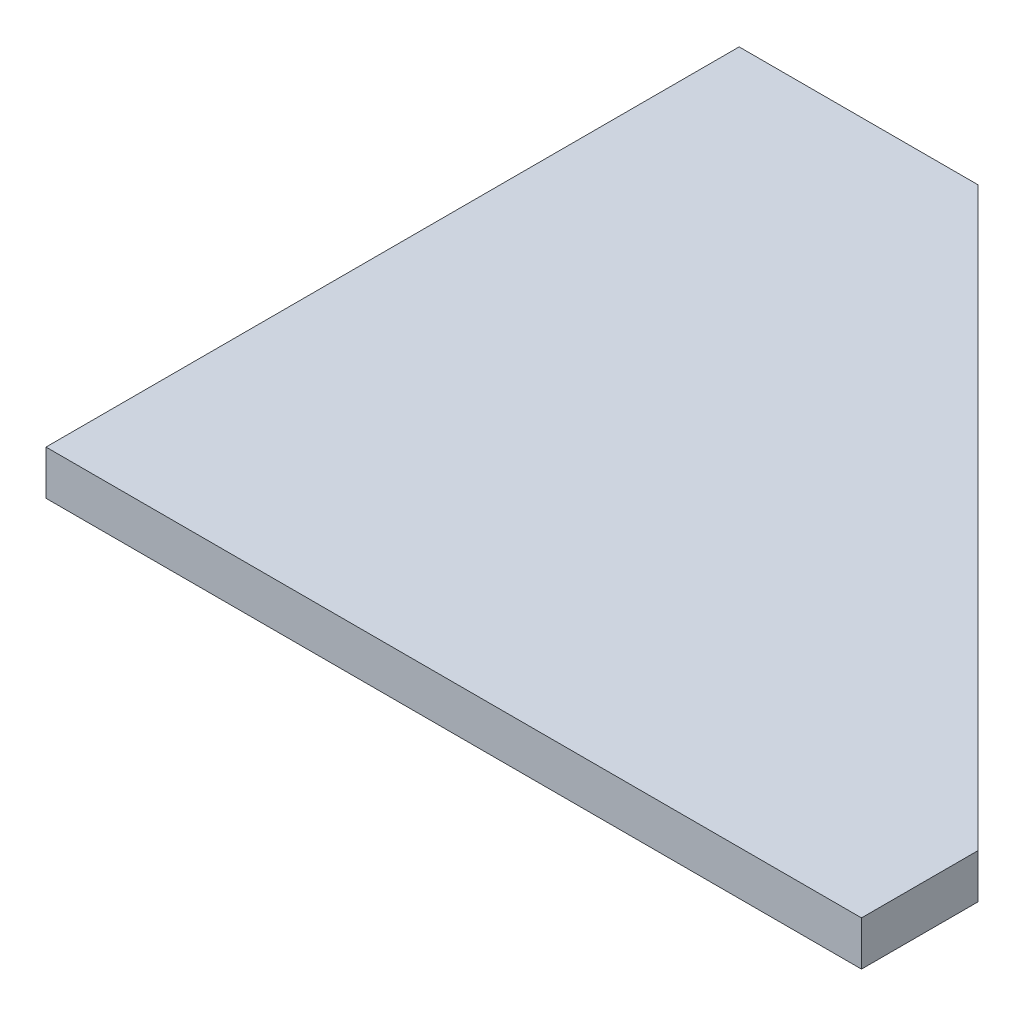
from build123d import *

# Parameters (mm, degrees)
BOSS_EXTRUDE1_DEPTH = 38.1
SKETCH2_W           = 19
SKETCH2_H           = 50
CUT_EXTRUDE1_DEPTH  = 2
CUT_EXTRUDE2_DEPTH  = 20


with BuildPart() as part:
    # Sketch1 → Boss-Extrude1 (new body)
    with BuildSketch(Plane(origin=(0, 0, 0), x_dir=(1, 0, 0), z_dir=(0, 1, 0))):
        Polygon((-144.97, 297.485), (350, -197.485), (350, -297.485), (-350, -297.485), (-350, 297.485), align=None)
    extrude(amount=BOSS_EXTRUDE1_DEPTH)

    # Sketch2 → Cut-Extrude1 (cut)
    with BuildSketch(Plane.XZ):
        with Locations((-340.5, -132.485)):
            Rectangle(SKETCH2_W, SKETCH2_H)
        with Locations((-340.5, 132.485)):
            Rectangle(SKETCH2_W, SKETCH2_H)
    extrude(amount=-CUT_EXTRUDE1_DEPTH, mode=Mode.SUBTRACT)

    # Sketch3 → Cut-Extrude2 (cut)
    with BuildSketch(Plane(origin=(0, 0, 0), x_dir=(1, 0, 0), z_dir=(0, 1, 0))):
        Polygon((-144.97, 297.485), (-186.716540118, 255.738459882), (-151.504050529, 221.687737324), (-111.028874503, 263.543874503), align=None)
    extrude(amount=CUT_EXTRUDE2_DEPTH, mode=Mode.SUBTRACT)


solid = part.part
